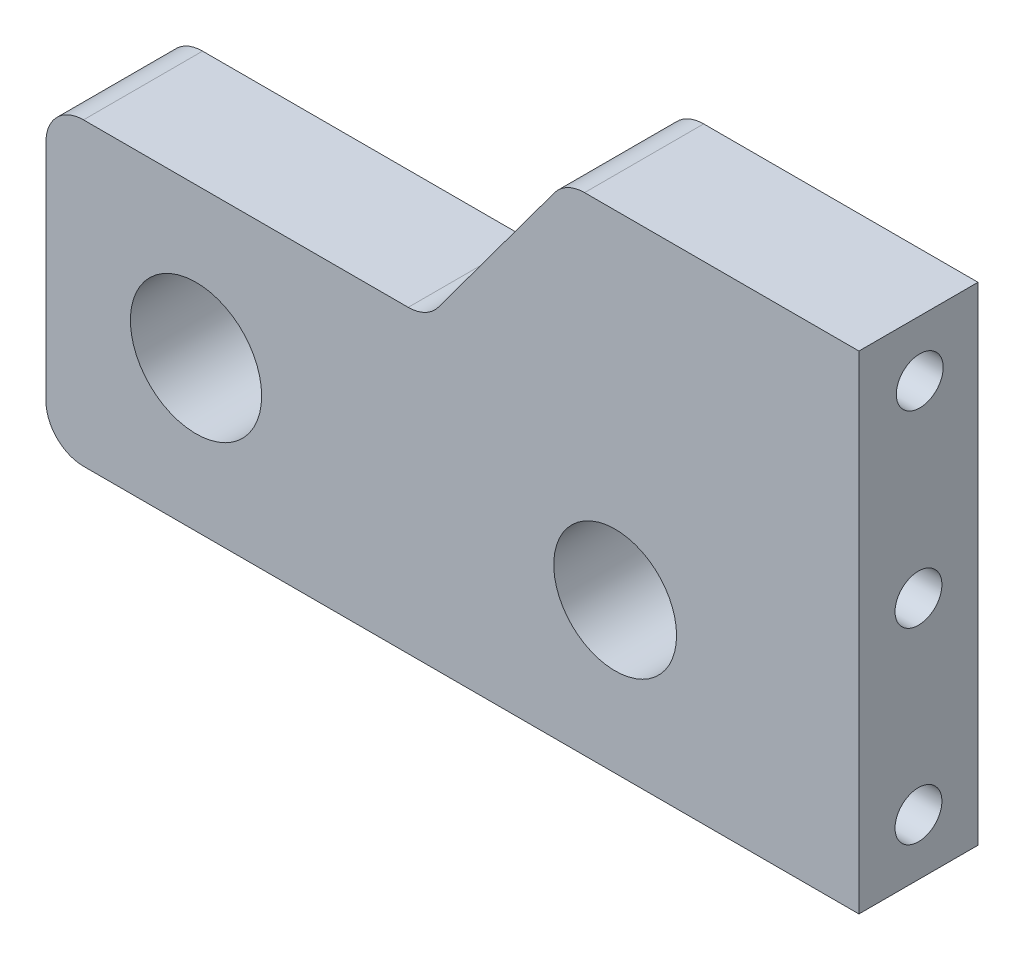
from build123d import *

# Parameters (mm, degrees)
SKETCH1_W           = 43.352
SKETCH1_H           = 16
BOSS_EXTRUDE1_DEPTH = 6.35
SKETCH1_6_R         = 3.275
SKETCH1_6_R_2       = 3.5
CUT_EXTRUDE1_DEPTH  = 6.35
FILLET1_R           = 2
SKETCH2_R           = 1.25
CUT_EXTRUDE2_DEPTH  = 5
BOSS_EXTRUDE2_DEPTH = 6.35
FILLET2_R           = 2
SKETCH4_R           = 1.25
CUT_EXTRUDE3_DEPTH  = 5


with BuildPart() as part:
    # Sketch1 → Boss-Extrude1 (new body)
    with BuildSketch(Plane.XY):
        with Locations((21.676, 8)):
            Rectangle(SKETCH1_W, SKETCH1_H)
    extrude(amount=BOSS_EXTRUDE1_DEPTH)

    # Sketch1<6> → Cut-Extrude1 (cut)
    with BuildSketch(Plane.XY):
        with Locations((30.352, 8)):
            Circle(SKETCH1_6_R)
        with Locations((8, 8)):
            Circle(SKETCH1_6_R_2)
    extrude(amount=CUT_EXTRUDE1_DEPTH, mode=Mode.SUBTRACT)

    # Fillet1
    fillet1_edges = [part.edges().sort_by_distance(p)[0] for p in [
        (0, 16, 3.175),
        (0, 0, 3.175),
    ]]
    fillet(fillet1_edges, radius=FILLET1_R)

    # Sketch2 → Cut-Extrude2 (cut)
    with BuildSketch(Plane(origin=(43.352, 0, 0), x_dir=(0, 0, -1), z_dir=(1, 0, 0))):
        with Locations((-3.175, 13)):
            Circle(SKETCH2_R)
        with Locations((-3.175, 3)):
            Circle(SKETCH2_R)
    extrude(amount=-CUT_EXTRUDE2_DEPTH, mode=Mode.SUBTRACT)

    # Sketch3 → Boss-Extrude2 (add)
    with BuildSketch(Plane.XY.offset(6.35)):
        Polygon((20.326281713, 16), (43.352, 16), (43.352, 26), (27.712043107, 26), align=None)
    extrude(amount=-BOSS_EXTRUDE2_DEPTH)

    # Fillet2
    fillet2_edges = [part.edges().sort_by_distance(p)[0] for p in [
        (20.326281713, 16, 3.175),
        (27.712043107, 26, 3.175),
    ]]
    fillet(fillet2_edges, radius=FILLET2_R)

    # Sketch4 → Cut-Extrude3 (cut)
    with BuildSketch(Plane(origin=(43.352, 0, 0), x_dir=(0, 0, -1), z_dir=(1, 0, 0))):
        with Locations((-3.10572404, 23)):
            Circle(SKETCH4_R)
    extrude(amount=-CUT_EXTRUDE3_DEPTH, mode=Mode.SUBTRACT)


solid = part.part
